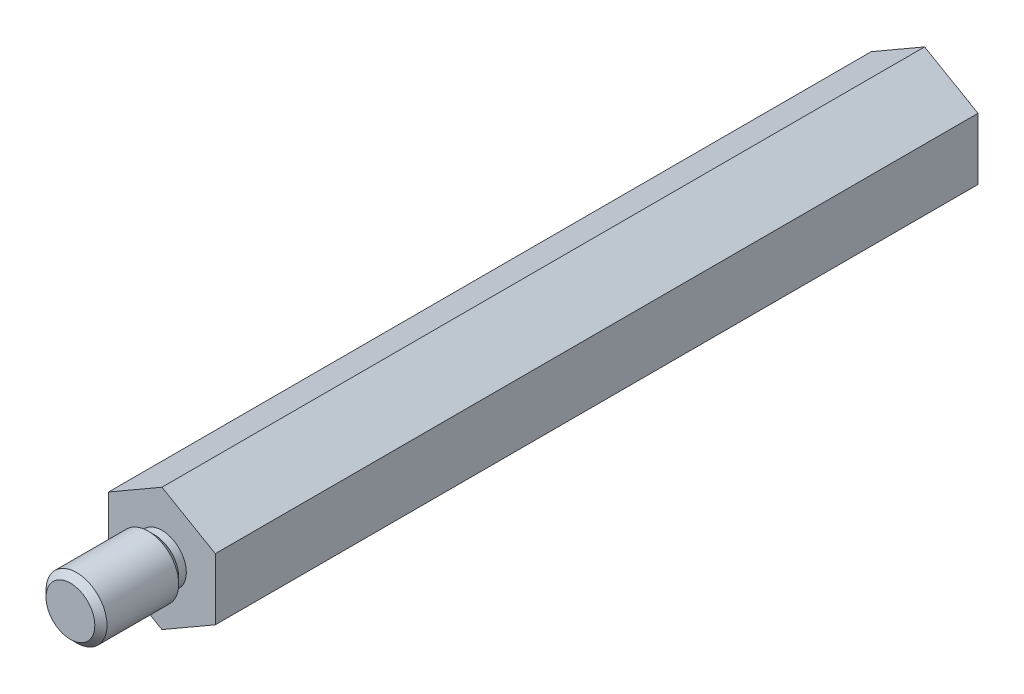
from build123d import *

# Parameters (mm, degrees)
EXTRUDE_1_DEPTH             = 50
SKETCH_2_R                  = 2
EXTRUDE_2_DEPTH             = 6
SKETCH_3_R                  = 2
SKETCH_3_R_2                = 1.6
CUT_EXTRUDE_3_DEPTH         = 0.5
CHAMFER_1_SIZE              = 0.4
HOLE_WIZARD_M31_D           = 2.2
HOLE_WIZARD_M31_DEPTH       = 8
HOLE_WIZARD_M31_CSINK_D     = 3
HOLE_WIZARD_M31_CSINK_ANGLE = 90
HOLE_WIZARD_M31_TIP         = 0.660946681


with BuildPart() as part:
    # Эскиз1 → Вытянуть1 (new body)
    with BuildSketch(Plane.XY):
        Polygon((0, 4.041451884), (-3.5, 2.020725942), (-3.5, -2.020725942), (0, -4.041451884), (3.5, -2.020725942), (3.5, 2.020725942), align=None)
    extrude(amount=EXTRUDE_1_DEPTH)

    # Эскиз2 → Вытянуть2 (add)
    with BuildSketch(Plane.XY.offset(50)):
        Circle(SKETCH_2_R)
    extrude(amount=EXTRUDE_2_DEPTH)

    # Эскиз3 → Вырез-Вытянуть3 (cut)
    with BuildSketch(Plane.XY.offset(50)):
        Circle(SKETCH_3_R)
        Circle(SKETCH_3_R_2, mode=Mode.SUBTRACT)
    extrude(amount=CUT_EXTRUDE_3_DEPTH, mode=Mode.SUBTRACT)

    # Фаска1
    chamfer_1_edges = [part.edges().sort_by_distance(p)[0] for p in [
        (-2, 0, 56),
        (-2, 0, 50.5),
    ]]
    chamfer(chamfer_1_edges, length=CHAMFER_1_SIZE - 0.0001)  # a hair under: the kernel refuses the full size

    # Отверстие с зазором M31
    with Locations(Plane(origin=(0, 0, 0), x_dir=(-1, 0, 0), z_dir=(0, 0, -1))):
        with Locations((0, 0)):
            CounterSinkHole(HOLE_WIZARD_M31_D / 2, HOLE_WIZARD_M31_CSINK_D / 2, depth=HOLE_WIZARD_M31_DEPTH, counter_sink_angle=HOLE_WIZARD_M31_CSINK_ANGLE)
            with Locations((0, 0, -(HOLE_WIZARD_M31_DEPTH + HOLE_WIZARD_M31_TIP / 2))):  # 118° drill point
                Cone(0, HOLE_WIZARD_M31_D / 2, HOLE_WIZARD_M31_TIP, mode=Mode.SUBTRACT)


solid = part.part
